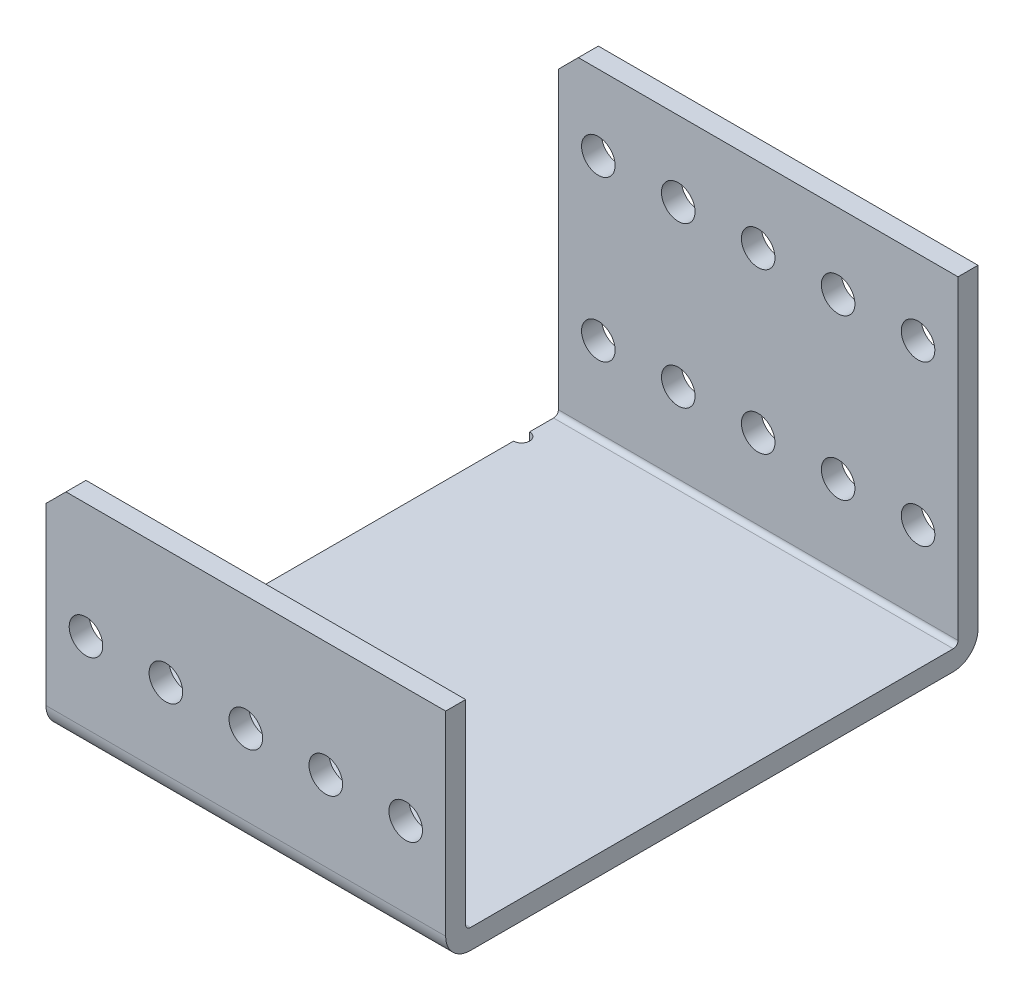
from build123d import *

# Parameters (mm, degrees)
SKETCH1_W            = 698.5
SKETCH1_H            = 84.582
BOSS_EXTRUDE1_DEPTH  = 34.925
SKETCH2_W            = 81.407
SKETCH2_H            = 31.75
CUT_EXTRUDE1_DEPTH   = 716.844146858
SKETCH3_W            = 698.5
SKETCH3_H            = 3.175
BOSS_EXTRUDE2_DEPTH  = 50.8
M2_CLEARANCE_HOLE1_D = 2.54
M5_CLEARANCE_HOLE1_D = 5.334
CHAMFER1_SIZE        = 3.175
FILLET1_R            = 0.762
FILLET2_R            = 3.937
SKETCH8_W            = 725.924928317
SKETCH8_H            = 218.216354959
CUT_EXTRUDE2_DEPTH   = 614.144311061
CUT_EXTRUDE3_REACH   = 184.584
SKETCH9_R            = 1.5875


with BuildPart() as part:
    # Sketch1 → Boss-Extrude1 (new body)
    with BuildSketch(Plane(origin=(0, 57.816398039, 0), x_dir=(1, 0, 0), z_dir=(0, 1, 0))):
        with Locations((253.148031467, -103.269491579)):
            Rectangle(SKETCH1_W, SKETCH1_H)
    extrude(amount=-BOSS_EXTRUDE1_DEPTH)

    # Sketch2 → Cut-Extrude1 (cut, through all)
    with BuildSketch(Plane(origin=(602.398031467, 0, 0), x_dir=(0, 0, -1), z_dir=(1, 0, 0))):
        with Locations((-101.681991579, 41.941398039)):
            Rectangle(SKETCH2_W, SKETCH2_H)
    extrude(amount=-CUT_EXTRUDE1_DEPTH, mode=Mode.SUBTRACT)

    # Sketch3 → Boss-Extrude2 (add)
    with BuildSketch(Plane(origin=(0, 26.066398039, 0), x_dir=(-1, 0, 0), z_dir=(0, 1, 0))):
        with Locations((-253.148031467, 62.565991579)):
            Rectangle(SKETCH3_W, SKETCH3_H)
    extrude(amount=BOSS_EXTRUDE2_DEPTH)

    # M2 Clearance Hole1 (through all)
    with Locations(Plane(origin=(0, 26.066398039, 0), x_dir=(1, 0, 0), z_dir=(0, 1, 0))):
        with Locations((-96.101968533, -136.543491579), (-96.101968533, -69.995491579)):
            Hole(M2_CLEARANCE_HOLE1_D / 2)

    # M5 Clearance Hole1 (through all)
    with Locations(Plane(origin=(0, 0, 60.978491579), x_dir=(-1, 0, 0), z_dir=(0, 0, -1))):
        with Locations((-469.048031467, 64.928398039), (-481.748031467, 64.928398039), (-469.048031467, 39.528398039), (-481.748031467, 39.528398039), (-456.348031467, 39.528398039), (-443.648031467, 39.528398039), (-430.948031467, 39.528398039), (-418.248031467, 39.528398039), (-405.548031467, 39.528398039), (-392.848031467, 39.528398039), (-380.148031467, 39.528398039), (-367.448031467, 39.528398039), (-354.748031467, 39.528398039), (-342.048031467, 39.528398039), (-329.348031467, 39.528398039), (-316.648031467, 39.528398039), (-303.948031467, 39.528398039), (-291.248031467, 39.528398039), (-278.548031467, 39.528398039), (-265.848031467, 39.528398039), (-253.148031467, 39.528398039), (-240.448031467, 39.528398039), (-227.748031467, 39.528398039), (-215.048031467, 39.528398039), (-202.348031467, 39.528398039), (-189.648031467, 39.528398039), (-176.948031467, 39.528398039), (-164.248031467, 39.528398039), (-151.548031467, 39.528398039), (-138.848031467, 39.528398039), (-126.148031467, 39.528398039), (-113.448031467, 39.528398039), (-100.748031467, 39.528398039), (-88.048031467, 39.528398039), (-75.348031467, 39.528398039), (-62.648031467, 39.528398039), (-49.948031467, 39.528398039), (-37.248031467, 39.528398039), (-24.548031467, 39.528398039), (-11.848031467, 39.528398039), (0.851968533, 39.528398039), (13.551968533, 39.528398039), (26.251968533, 39.528398039), (38.951968533, 39.528398039), (51.651968533, 39.528398039), (64.351968533, 39.528398039), (77.051968533, 39.528398039), (89.751968533, 39.528398039), (-456.348031467, 64.928398039), (-443.648031467, 64.928398039), (-430.948031467, 64.928398039), (-418.248031467, 64.928398039), (-405.548031467, 64.928398039), (-392.848031467, 64.928398039), (-380.148031467, 64.928398039), (-367.448031467, 64.928398039), (-354.748031467, 64.928398039), (-342.048031467, 64.928398039), (-329.348031467, 64.928398039), (-316.648031467, 64.928398039), (-303.948031467, 64.928398039), (-291.248031467, 64.928398039), (-278.548031467, 64.928398039), (-265.848031467, 64.928398039), (-253.148031467, 64.928398039), (-240.448031467, 64.928398039), (-227.748031467, 64.928398039), (-215.048031467, 64.928398039), (-202.348031467, 64.928398039), (-189.648031467, 64.928398039), (-176.948031467, 64.928398039), (-164.248031467, 64.928398039), (-151.548031467, 64.928398039), (-138.848031467, 64.928398039), (-126.148031467, 64.928398039), (-113.448031467, 64.928398039), (-100.748031467, 64.928398039), (-88.048031467, 64.928398039), (-75.348031467, 64.928398039), (-62.648031467, 64.928398039), (-49.948031467, 64.928398039), (-37.248031467, 64.928398039), (-24.548031467, 64.928398039), (-11.848031467, 64.928398039), (0.851968533, 64.928398039), (13.551968533, 64.928398039), (26.251968533, 64.928398039), (38.951968533, 64.928398039), (51.651968533, 64.928398039), (64.351968533, 64.928398039), (77.051968533, 64.928398039), (89.751968533, 64.928398039), (-494.448031467, 64.928398039), (-494.448031467, 39.528398039), (-507.148031467, 64.928398039), (-507.148031467, 39.528398039), (-519.848031467, 64.928398039), (-519.848031467, 39.528398039), (-532.548031467, 64.928398039), (-532.548031467, 39.528398039), (-545.248031467, 64.928398039), (-545.248031467, 39.528398039), (-557.948031467, 64.928398039), (-557.948031467, 39.528398039), (-570.648031467, 64.928398039), (-570.648031467, 39.528398039), (-583.348031467, 64.928398039), (-583.348031467, 39.528398039), (-596.048031467, 64.928398039), (-596.048031467, 39.528398039)):
            Hole(M5_CLEARANCE_HOLE1_D / 2)

    # Chamfer1
    chamfer1_edges = [part.edges().sort_by_distance(p)[0] for p in [
        (602.398031467, 76.866398039, 62.565991579),
        (-96.101968533, 57.816398039, 143.972991579),
        (602.398031467, 57.816398039, 143.972991579),
        (-96.101968533, 76.866398039, 62.565991579),
    ]]
    chamfer(chamfer1_edges, length=CHAMFER1_SIZE)

    # Fillet1
    fillet1_edges = [part.edges().sort_by_distance(p)[0] for p in [
        (253.148031467, 26.066398039, 64.153491579),
        (253.148031467, 26.066398039, 142.385491579),
    ]]
    fillet(fillet1_edges, radius=FILLET1_R)

    # Fillet2
    fillet2_edges = [part.edges().sort_by_distance(p)[0] for p in [
        (253.148031467, 22.891398039, 145.560491579),
        (253.148031467, 22.891398039, 60.978491579),
    ]]
    fillet(fillet2_edges, radius=FILLET2_R)

    # Sketch8 → Cut-Extrude2 (cut, through all)
    with BuildSketch(Plane(origin=(0, 0, 60.978491579), x_dir=(-1, 0, 0), z_dir=(0, 0, -1))):
        with Locations((-330.360495626, 61.250645378)):
            Rectangle(SKETCH8_W, SKETCH8_H)
    extrude(amount=-CUT_EXTRUDE2_DEPTH, mode=Mode.SUBTRACT)

    # Sketch9 → Cut-Extrude3 (cut, up to next)
    with BuildSketch(Plane.XZ.offset(-22.891398039), mode=Mode.PRIVATE) as cut_extrude3_sk1:
        with Locations((-54.826968533, 127.203984083)):
            Circle(SKETCH9_R)
    cut_extrude3_tool1 = extrude(cut_extrude3_sk1.sketch, amount=-CUT_EXTRUDE3_REACH, mode=Mode.PRIVATE) & part.part
    # Sketch9 → Cut-Extrude3 (cut, up to next)
    with BuildSketch(Plane.XZ.offset(-22.891398039), mode=Mode.PRIVATE) as cut_extrude3_sk2:
        with Locations((-73.876968533, 127.203984083)):
            Circle(SKETCH9_R)
    cut_extrude3_tool2 = extrude(cut_extrude3_sk2.sketch, amount=-CUT_EXTRUDE3_REACH, mode=Mode.PRIVATE) & part.part
    add(cut_extrude3_tool1.solids().sort_by_distance((-54.826969, 22.891398, 127.203984))[0], mode=Mode.SUBTRACT)
    add(cut_extrude3_tool2.solids().sort_by_distance((-73.876969, 22.891398, 127.203984))[0], mode=Mode.SUBTRACT)


solid = part.part
